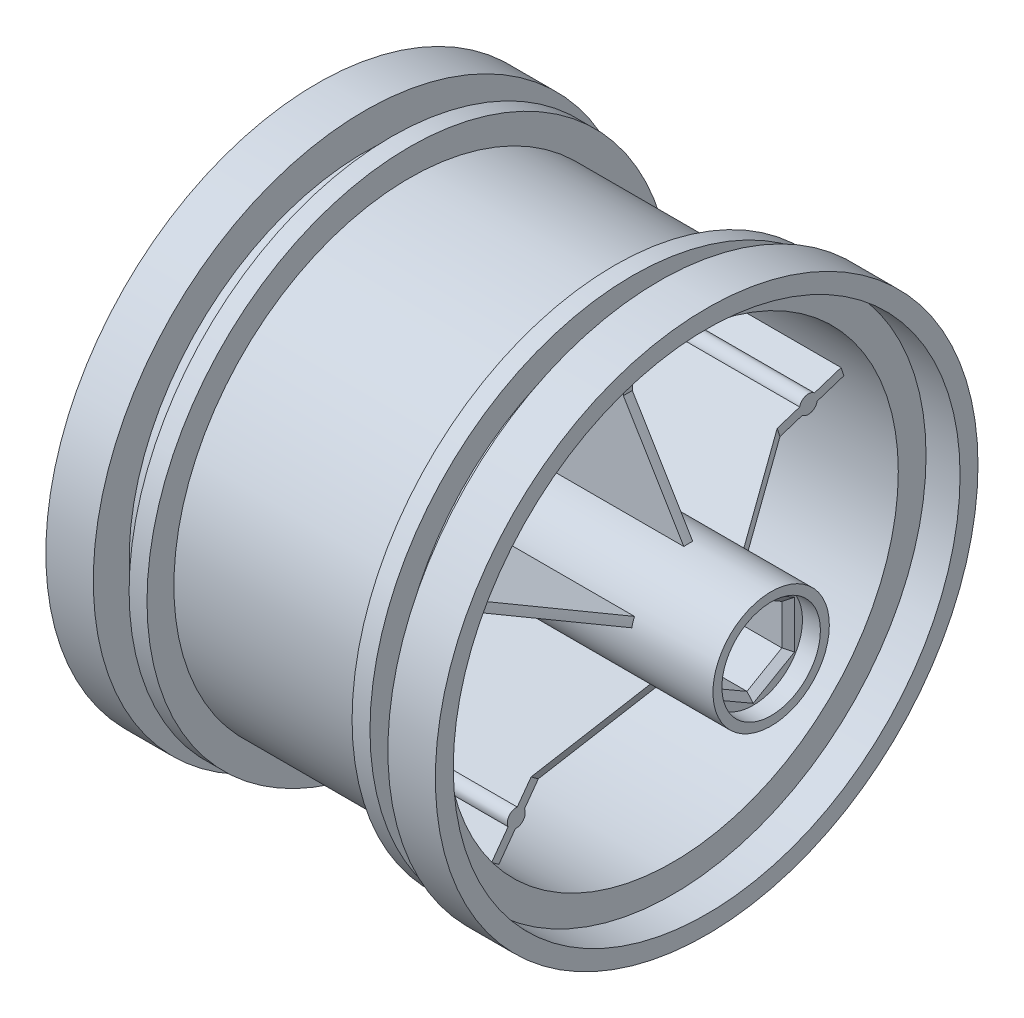
from build123d import *

# Parameters (mm, degrees)
CUT_EXTRUDE2_DEPTH  = 13
CHAMFER1_SIZE       = 0.7
SKETCH3_R           = 1.15
CUT_EXTRUDE3_DEPTH  = 56.815788354
SKETCH4_R           = 3
CUT_EXTRUDE4_DEPTH  = 19.5
BOSS_EXTRUDE1_REACH = 57.139
SKETCH6_W           = 2
SKETCH6_H           = 9.751628328
CUT_EXTRUDE7_DEPTH  = 0.5
CUT_EXTRUDE8_REACH  = 63.108
CUT_EXTRUDE9_DEPTH  = 67.382753784
FILLET3_R           = 0.3


with BuildPart() as part:
    # Sketch1 → Revolve1 (revolve)
    with BuildSketch(Plane.XY):
        with BuildLine():
            Line((-16.35, 0), (-16.35, 8.25))
            Line((-16.35, 8.25), (-14.85, 8.25))
            Line((-14.85, 8.25), (-14.85, 8.940811112))
            Line((-14.85, 8.940811112), (-27.35, 24.6))
            Line((-27.35, 24.6), (-29.35, 24.6))
            ThreePointArc((-29.35, 24.6), (-31.731701073, 25.735107238), (-32.35, 28.3))
            Line((-32.35, 28.3), (-32.35, 30.3))
            Line((-32.35, 30.3), (-27.05, 30.3))
            Line((-27.05, 30.3), (-27.05, 26.3))
            Line((-27.05, 26.3), (-24.05, 26.3))
            Line((-24.05, 26.3), (-24.05, 29.3))
            Line((-24.05, 29.3), (-22.05, 29.3))
            Line((-22.05, 29.3), (-22.05, 26.3))
            Line((-22.05, 26.3), (0.85, 26.3))
            Line((0.85, 26.3), (0.85, 29.3))
            Line((0.85, 29.3), (2.85, 29.3))
            Line((2.85, 29.3), (2.85, 26.3))
            Line((2.85, 26.3), (5.85, 26.3))
            Line((5.85, 26.3), (5.85, 30.3))
            Line((5.85, 30.3), (11.15, 30.3))
            Line((11.15, 30.3), (11.15, 28.3))
            Line((11.15, 28.3), (7.35, 28.3))
            Line((7.35, 28.3), (7.35, 25.2))
            Line((7.35, 25.2), (2.35, 25.2))
            Line((2.35, 25.2), (2.35, 17.7))
            Line((2.35, 17.7), (9.1, 6.5))
            Line((9.1, 6.5), (18.35, 6.5))
            Line((18.35, 6.5), (18.35, 5.5))
            Line((18.35, 5.5), (16.35, 5.5))
            Line((16.35, 5.5), (16.35, 0))
            Line((16.35, 0), (-16.35, 0))
        make_face()
    revolve(axis=Axis((16.35, 0, 0), (-1, 0, 0)))

    # Sketch2 → Cut-Extrude2 (cut)
    with BuildSketch(Plane(origin=(16.35, 0, 0), x_dir=(0, 0, -1), z_dir=(1, 0, 0))):
        Polygon((0, -4.5), (3.897114317, -2.25), (3.897114317, 2.25), (0, 4.5), (-3.897114317, 2.25), (-3.897114317, -2.25), align=None)
    extrude(amount=-CUT_EXTRUDE2_DEPTH, mode=Mode.SUBTRACT)

    # Chamfer1
    chamfer1_edges = [part.edges().sort_by_distance(p)[0] for p in [
        (16.35, -3.375, -1.948557159),
        (16.35, -3.375, 1.948557159),
        (16.35, 0, 3.897114317),
        (16.35, 3.375, 1.948557159),
        (16.35, 3.375, -1.948557159),
        (16.35, 0, -3.897114317),
    ]]
    chamfer(chamfer1_edges, length=CHAMFER1_SIZE)

    # Sketch3 → Cut-Extrude3 (cut, through all)
    with BuildSketch(Plane(origin=(3.35, 0, 0), x_dir=(0, 0, -1), z_dir=(1, 0, 0))):
        Circle(SKETCH3_R)
    extrude(amount=-CUT_EXTRUDE3_DEPTH, mode=Mode.SUBTRACT)

    # Sketch4 → Cut-Extrude4 (cut)
    with BuildSketch(Plane.ZY.offset(16.35)):
        Circle(SKETCH4_R)
    extrude(amount=-CUT_EXTRUDE4_DEPTH, mode=Mode.SUBTRACT)

    # Sketch6 → Boss-Extrude1 (add, up to next)
    with BuildSketch(Plane.ZY.offset(16.35), mode=Mode.PRIVATE) as boss_extrude1_sk1:
        with Locations((0, 10.317183644)):
            Rectangle(SKETCH6_W, SKETCH6_H)
    boss_extrude1_tool1 = extrude(boss_extrude1_sk1.sketch, amount=-BOSS_EXTRUDE1_REACH, mode=Mode.PRIVATE) - part.part
    # Sketch6 → Boss-Extrude1 (add, up to next)
    with BuildSketch(Plane.ZY.offset(16.35), mode=Mode.PRIVATE) as boss_extrude1_sk2:
        Polygon((5.484066896, 0.730419126), (14.758416562, 3.743838002), (14.140382573, 5.645951034), (4.866032907, 2.632532158), align=None)
    boss_extrude1_tool2 = extrude(boss_extrude1_sk2.sketch, amount=-BOSS_EXTRUDE1_REACH, mode=Mode.PRIVATE) - part.part
    # Sketch6 → Boss-Extrude1 (add, up to next)
    with BuildSketch(Plane.ZY.offset(16.35), mode=Mode.PRIVATE) as boss_extrude1_sk3:
        Polygon((2.389339738, -4.989945634), (8.121203055, -12.879178674), (9.739237044, -11.70360817), (4.007373727, -3.81437513), align=None)
    boss_extrude1_tool3 = extrude(boss_extrude1_sk3.sketch, amount=-BOSS_EXTRUDE1_REACH, mode=Mode.PRIVATE) - part.part
    # Sketch6 → Boss-Extrude1 (add, up to next)
    with BuildSketch(Plane.ZY.offset(16.35), mode=Mode.PRIVATE) as boss_extrude1_sk4:
        Polygon((-4.007373727, -3.81437513), (-9.739237044, -11.70360817), (-8.121203055, -12.879178674), (-2.389339738, -4.989945634), align=None)
    boss_extrude1_tool4 = extrude(boss_extrude1_sk4.sketch, amount=-BOSS_EXTRUDE1_REACH, mode=Mode.PRIVATE) - part.part
    # Sketch6 → Boss-Extrude1 (add, up to next)
    with BuildSketch(Plane.ZY.offset(16.35), mode=Mode.PRIVATE) as boss_extrude1_sk5:
        Polygon((-4.866032907, 2.632532158), (-14.140382573, 5.645951034), (-14.758416562, 3.743838002), (-5.484066896, 0.730419126), align=None)
    boss_extrude1_tool5 = extrude(boss_extrude1_sk5.sketch, amount=-BOSS_EXTRUDE1_REACH, mode=Mode.PRIVATE) - part.part
    add(boss_extrude1_tool1.solids().sort_by_distance((-16.35, 10.317184, 0))[0])
    add(boss_extrude1_tool2.solids().sort_by_distance((-16.35, 3.188185, 9.812225))[0])
    add(boss_extrude1_tool3.solids().sort_by_distance((-16.35, -8.346777, 6.064288))[0])
    add(boss_extrude1_tool4.solids().sort_by_distance((-16.35, -8.346777, -6.064288))[0])
    add(boss_extrude1_tool5.solids().sort_by_distance((-16.35, 3.188185, -9.812225))[0])

    # Sketch7 → Cut-Extrude7 (cut)
    with BuildSketch(Plane.ZY.offset(32.35)):
        with BuildLine():
            Line((-1.5, 26.457513111), (-1, 27.231645195))
            ThreePointArc((-1, 27.231645195), (0, 27.25), (1, 27.231645195))
            Line((1, 27.231645195), (1.5, 26.457513111))
            ThreePointArc((1.5, 26.457513111), (0, 26.5), (-1.5, 26.457513111))
        make_face()
        with BuildLine():
            Line((4.033604885, 26.191220507), (4.683629795, 26.844480102))
            ThreePointArc((4.683629795, 26.844480102), (5.665593575, 26.65452212), (6.639924997, 26.42865672))
            Line((6.639924997, 26.42865672), (6.968047687, 25.567485434))
            ThreePointArc((6.968047687, 25.567485434), (5.509659807, 25.920911419), (4.033604885, 26.191220507))
        make_face()
        with BuildLine():
            Line((9.39092188, 24.780245887), (10.162562494, 25.284082415))
            ThreePointArc((10.162562494, 25.284082415), (11.083573524, 24.894113721), (11.989653409, 24.470609129))
            Line((11.989653409, 24.470609129), (12.131558253, 23.560035958))
            ThreePointArc((12.131558253, 23.560035958), (10.778521042, 24.208954628), (9.39092188, 24.780245887))
        make_face()
        with BuildLine():
            Line((14.337810527, 22.286255614), (15.197342447, 22.618648999))
            ThreePointArc((15.197342447, 22.618648999), (16.017148125, 22.045713097), (16.815376435, 21.443078495))
            Line((16.815376435, 21.443078495), (16.76486151, 20.522899857))
            ThreePointArc((16.76486151, 20.522899857), (15.576309186, 21.438950351), (14.337810527, 22.286255614))
        make_face()
        with BuildLine():
            Line((18.658068054, 18.818249029), (19.567925609, 18.964672087))
            ThreePointArc((19.567925609, 18.964672087), (20.250696494, 18.233809023), (20.906186822, 17.478382436))
            Line((20.906186822, 17.478382436), (20.665459873, 16.588814552))
            ThreePointArc((20.665459873, 16.588814552), (19.693337875, 17.731961069), (18.658068054, 18.818249029))
        make_face()
        with BuildLine():
            Line((22.162878475, 14.527794661), (23.083296525, 14.481848001))
            ThreePointArc((23.083296525, 14.481848001), (23.599192253, 13.625), (24.083296525, 12.749797193))
            Line((24.083296525, 12.749797193), (23.662878475, 11.92971845))
            ThreePointArc((23.662878475, 11.92971845), (22.9496732, 13.25), (22.162878475, 14.527794661))
        make_face()
        with BuildLine():
            Line((24.699064757, 9.602405955), (25.589816617, 9.366097666))
            ThreePointArc((25.589816617, 9.366097666), (25.916290069, 8.420713097), (26.207850606, 7.463984634))
            Line((26.207850606, 7.463984634), (25.62611574, 6.749236406))
            ThreePointArc((25.62611574, 6.749236406), (25.202997682, 8.188950351), (24.699064757, 9.602405955))
        make_face()
        with BuildLine():
            Line((26.155783391, 4.25734603), (26.97793893, 3.84100392))
            ThreePointArc((26.97793893, 3.84100392), (27.100721649, 2.848400624), (27.186995856, 1.851960129))
            Line((27.186995856, 1.851960129), (26.46936878, 1.273780344))
            ThreePointArc((26.46936878, 1.273780344), (26.354830227, 2.770004277), (26.155783391, 4.25734603))
        make_face()
        with BuildLine():
            Line((26.46936878, -1.273780344), (27.186995856, -1.851960129))
            ThreePointArc((27.186995856, -1.851960129), (27.100721649, -2.848400624), (26.97793893, -3.84100392))
            Line((26.97793893, -3.84100392), (26.155783391, -4.25734603))
            ThreePointArc((26.155783391, -4.25734603), (26.354830227, -2.770004277), (26.46936878, -1.273780344))
        make_face()
        with BuildLine():
            Line((25.62611574, -6.749236406), (26.207850606, -7.463984634))
            ThreePointArc((26.207850606, -7.463984634), (25.916290069, -8.420713097), (25.589816617, -9.366097666))
            Line((25.589816617, -9.366097666), (24.699064757, -9.602405955))
            ThreePointArc((24.699064757, -9.602405955), (25.202997682, -8.188950351), (25.62611574, -6.749236406))
        make_face()
        with BuildLine():
            Line((23.662878475, -11.92971845), (24.083296525, -12.749797193))
            ThreePointArc((24.083296525, -12.749797193), (23.599192253, -13.625), (23.083296525, -14.481848001))
            Line((23.083296525, -14.481848001), (22.162878475, -14.527794661))
            ThreePointArc((22.162878475, -14.527794661), (22.9496732, -13.25), (23.662878475, -11.92971845))
        make_face()
        with BuildLine():
            Line((20.665459873, -16.588814552), (20.906186822, -17.478382436))
            ThreePointArc((20.906186822, -17.478382436), (20.250696494, -18.233809023), (19.567925609, -18.964672087))
            Line((19.567925609, -18.964672087), (18.658068054, -18.818249029))
            ThreePointArc((18.658068054, -18.818249029), (19.693337875, -17.731961069), (20.665459873, -16.588814552))
        make_face()
        with BuildLine():
            Line((16.76486151, -20.522899857), (16.815376435, -21.443078495))
            ThreePointArc((16.815376435, -21.443078495), (16.017148125, -22.045713097), (15.197342447, -22.618648999))
            Line((15.197342447, -22.618648999), (14.337810527, -22.286255614))
            ThreePointArc((14.337810527, -22.286255614), (15.576309186, -21.438950351), (16.76486151, -20.522899857))
        make_face()
        with BuildLine():
            Line((12.131558253, -23.560035958), (11.989653409, -24.470609129))
            ThreePointArc((11.989653409, -24.470609129), (11.083573524, -24.894113721), (10.162562494, -25.284082415))
            Line((10.162562494, -25.284082415), (9.39092188, -24.780245887))
            ThreePointArc((9.39092188, -24.780245887), (10.778521042, -24.208954628), (12.131558253, -23.560035958))
        make_face()
        with BuildLine():
            Line((6.968047687, -25.567485434), (6.639924997, -26.42865672))
            ThreePointArc((6.639924997, -26.42865672), (5.665593575, -26.65452212), (4.683629795, -26.844480102))
            Line((4.683629795, -26.844480102), (4.033604885, -26.191220507))
            ThreePointArc((4.033604885, -26.191220507), (5.509659807, -25.920911419), (6.968047687, -25.567485434))
        make_face()
        with BuildLine():
            Line((1.5, -26.457513111), (1, -27.231645195))
            ThreePointArc((1, -27.231645195), (0, -27.25), (-1, -27.231645195))
            Line((-1, -27.231645195), (-1.5, -26.457513111))
            ThreePointArc((-1.5, -26.457513111), (0, -26.5), (1.5, -26.457513111))
        make_face()
        with BuildLine():
            Line((-4.033604885, -26.191220507), (-4.683629795, -26.844480102))
            ThreePointArc((-4.683629795, -26.844480102), (-5.665593575, -26.65452212), (-6.639924997, -26.42865672))
            Line((-6.639924997, -26.42865672), (-6.968047687, -25.567485434))
            ThreePointArc((-6.968047687, -25.567485434), (-5.509659807, -25.920911419), (-4.033604885, -26.191220507))
        make_face()
        with BuildLine():
            Line((-9.39092188, -24.780245887), (-10.162562494, -25.284082415))
            ThreePointArc((-10.162562494, -25.284082415), (-11.083573524, -24.894113721), (-11.989653409, -24.470609129))
            Line((-11.989653409, -24.470609129), (-12.131558253, -23.560035958))
            ThreePointArc((-12.131558253, -23.560035958), (-10.778521042, -24.208954628), (-9.39092188, -24.780245887))
        make_face()
        with BuildLine():
            Line((-14.337810527, -22.286255614), (-15.197342447, -22.618648999))
            ThreePointArc((-15.197342447, -22.618648999), (-16.017148125, -22.045713097), (-16.815376435, -21.443078495))
            Line((-16.815376435, -21.443078495), (-16.76486151, -20.522899857))
            ThreePointArc((-16.76486151, -20.522899857), (-15.576309186, -21.438950351), (-14.337810527, -22.286255614))
        make_face()
        with BuildLine():
            Line((-18.658068054, -18.818249029), (-19.567925609, -18.964672087))
            ThreePointArc((-19.567925609, -18.964672087), (-20.250696494, -18.233809023), (-20.906186822, -17.478382436))
            Line((-20.906186822, -17.478382436), (-20.665459873, -16.588814552))
            ThreePointArc((-20.665459873, -16.588814552), (-19.693337875, -17.731961069), (-18.658068054, -18.818249029))
        make_face()
        with BuildLine():
            Line((-22.162878475, -14.527794661), (-23.083296525, -14.481848001))
            ThreePointArc((-23.083296525, -14.481848001), (-23.599192253, -13.625), (-24.083296525, -12.749797193))
            Line((-24.083296525, -12.749797193), (-23.662878475, -11.92971845))
            ThreePointArc((-23.662878475, -11.92971845), (-22.9496732, -13.25), (-22.162878475, -14.527794661))
        make_face()
        with BuildLine():
            Line((-24.699064757, -9.602405955), (-25.589816617, -9.366097666))
            ThreePointArc((-25.589816617, -9.366097666), (-25.916290069, -8.420713097), (-26.207850606, -7.463984634))
            Line((-26.207850606, -7.463984634), (-25.62611574, -6.749236406))
            ThreePointArc((-25.62611574, -6.749236406), (-25.202997682, -8.188950351), (-24.699064757, -9.602405955))
        make_face()
        with BuildLine():
            Line((-26.155783391, -4.25734603), (-26.97793893, -3.84100392))
            ThreePointArc((-26.97793893, -3.84100392), (-27.100721649, -2.848400624), (-27.186995856, -1.851960129))
            Line((-27.186995856, -1.851960129), (-26.46936878, -1.273780344))
            ThreePointArc((-26.46936878, -1.273780344), (-26.354830227, -2.770004277), (-26.155783391, -4.25734603))
        make_face()
        with BuildLine():
            Line((-26.46936878, 1.273780344), (-27.186995856, 1.851960129))
            ThreePointArc((-27.186995856, 1.851960129), (-27.100721649, 2.848400624), (-26.97793893, 3.84100392))
            Line((-26.97793893, 3.84100392), (-26.155783391, 4.25734603))
            ThreePointArc((-26.155783391, 4.25734603), (-26.354830227, 2.770004277), (-26.46936878, 1.273780344))
        make_face()
        with BuildLine():
            Line((-25.62611574, 6.749236406), (-26.207850606, 7.463984634))
            ThreePointArc((-26.207850606, 7.463984634), (-25.916290069, 8.420713097), (-25.589816617, 9.366097666))
            Line((-25.589816617, 9.366097666), (-24.699064757, 9.602405955))
            ThreePointArc((-24.699064757, 9.602405955), (-25.202997682, 8.188950351), (-25.62611574, 6.749236406))
        make_face()
        with BuildLine():
            Line((-23.662878475, 11.92971845), (-24.083296525, 12.749797193))
            ThreePointArc((-24.083296525, 12.749797193), (-23.599192253, 13.625), (-23.083296525, 14.481848001))
            Line((-23.083296525, 14.481848001), (-22.162878475, 14.527794661))
            ThreePointArc((-22.162878475, 14.527794661), (-22.9496732, 13.25), (-23.662878475, 11.92971845))
        make_face()
        with BuildLine():
            Line((-20.665459873, 16.588814552), (-20.906186822, 17.478382436))
            ThreePointArc((-20.906186822, 17.478382436), (-20.250696494, 18.233809023), (-19.567925609, 18.964672087))
            Line((-19.567925609, 18.964672087), (-18.658068054, 18.818249029))
            ThreePointArc((-18.658068054, 18.818249029), (-19.693337875, 17.731961069), (-20.665459873, 16.588814552))
        make_face()
        with BuildLine():
            Line((-16.76486151, 20.522899857), (-16.815376435, 21.443078495))
            ThreePointArc((-16.815376435, 21.443078495), (-16.017148125, 22.045713097), (-15.197342447, 22.618648999))
            Line((-15.197342447, 22.618648999), (-14.337810527, 22.286255614))
            ThreePointArc((-14.337810527, 22.286255614), (-15.576309186, 21.438950351), (-16.76486151, 20.522899857))
        make_face()
        with BuildLine():
            Line((-12.131558253, 23.560035958), (-11.989653409, 24.470609129))
            ThreePointArc((-11.989653409, 24.470609129), (-11.083573524, 24.894113721), (-10.162562494, 25.284082415))
            Line((-10.162562494, 25.284082415), (-9.39092188, 24.780245887))
            ThreePointArc((-9.39092188, 24.780245887), (-10.778521042, 24.208954628), (-12.131558253, 23.560035958))
        make_face()
        with BuildLine():
            Line((-6.968047687, 25.567485434), (-6.639924997, 26.42865672))
            ThreePointArc((-6.639924997, 26.42865672), (-5.665593575, 26.65452212), (-4.683629795, 26.844480102))
            Line((-4.683629795, 26.844480102), (-4.033604885, 26.191220507))
            ThreePointArc((-4.033604885, 26.191220507), (-5.509659807, 25.920911419), (-6.968047687, 25.567485434))
        make_face()
    extrude(amount=-CUT_EXTRUDE7_DEPTH, mode=Mode.SUBTRACT)

    # Cut-Extrude8: up to this cone (the profile starts outside it)
    cut_extrude8_end = Plane(origin=(11.15, 0, 0), z_dir=(-1, 0, 0)).offset(18.862968571) * Cone(1.253e-06, 56.053673167, 44.745031429, align=(Align.CENTER, Align.CENTER, Align.MIN), mode=Mode.PRIVATE)
    # Sketch10 → Cut-Extrude8 (cut, up to the surface)
    with BuildSketch(Plane(origin=(11.15, 0, 0), x_dir=(0, 0, -1), z_dir=(1, 0, 0)), mode=Mode.PRIVATE) as cut_extrude8_sk1:
        with BuildLine():
            Line((0.5, 25.195039194), (0.5, 22.066025404))
            ThreePointArc((0.5, 22.066025404), (1, 21.2), (0.5, 20.333974596))
            Line((0.5, 20.333974596), (0.5, 6.480740698))
            ThreePointArc((0.5, 6.480740698), (3.82060414, 5.258610463), (6.009042174, 2.47818727))
            Line((6.009042174, 2.47818727), (19.184250545, 6.759071972))
            ThreePointArc((19.184250545, 6.759071972), (19.853381151, 7.502216797), (20.831528752, 7.294305106))
            Line((20.831528752, 7.294305106), (23.807397707, 8.261223543))
            ThreePointArc((23.807397707, 8.261223543), (14.812188358, 20.387228258), (0.5, 25.195039194))
        make_face()
    cut_extrude8_tool1 = extrude(cut_extrude8_sk1.sketch, amount=-CUT_EXTRUDE8_REACH, mode=Mode.PRIVATE) - cut_extrude8_end
    add(cut_extrude8_tool1.solids().sort_by_distance((11.15, 13.537997, -9.835931))[0], mode=Mode.SUBTRACT)
    # Sketch10 → Cut-Extrude8 (cut, up to the surface)
    with BuildSketch(Plane(origin=(11.15, 0, 0), x_dir=(0, 0, -1), z_dir=(1, 0, 0)), mode=Mode.PRIVATE) as cut_extrude8_sk2:
        with BuildLine():
            Line((-0.5, 20.333974596), (-0.5, 6.480740698))
            ThreePointArc((-0.5, 6.480740698), (-3.82060414, 5.258610463), (-6.009042174, 2.47818727))
            Line((-6.009042174, 2.47818727), (-19.184250545, 6.759071972))
            ThreePointArc((-19.184250545, 6.759071972), (-19.853381151, 7.502216797), (-20.831528752, 7.294305106))
            Line((-20.831528752, 7.294305106), (-23.807397707, 8.261223543))
            ThreePointArc((-23.807397707, 8.261223543), (-14.812188358, 20.387228258), (-0.5, 25.195039194))
            Line((-0.5, 25.195039194), (-0.5, 22.066025404))
            ThreePointArc((-0.5, 22.066025404), (-1, 21.2), (-0.5, 20.333974596))
        make_face()
    cut_extrude8_tool2 = extrude(cut_extrude8_sk2.sketch, amount=-CUT_EXTRUDE8_REACH, mode=Mode.PRIVATE) - cut_extrude8_end
    add(cut_extrude8_tool2.solids().sort_by_distance((11.15, 13.537997, 9.835931))[0], mode=Mode.SUBTRACT)
    # Sketch10 → Cut-Extrude8 (cut, up to the surface)
    with BuildSketch(Plane(origin=(11.15, 0, 0), x_dir=(0, 0, -1), z_dir=(1, 0, 0)), mode=Mode.PRIVATE) as cut_extrude8_sk3:
        with BuildLine():
            Line((24.116414701, 7.310167027), (21.140545746, 6.34324859))
            ThreePointArc((21.140545746, 6.34324859), (20.47141514, 5.600103764), (19.493267539, 5.808015455))
            Line((19.493267539, 5.808015455), (6.318059169, 1.527130754))
            ThreePointArc((6.318059169, 1.527130754), (6.181867356, -2.008610463), (4.213792304, -4.949136735))
            Line((4.213792304, -4.949136735), (12.356518885, -16.156638385))
            ThreePointArc((12.356518885, -16.156638385), (13.270064343, -16.563375028), (13.374592806, -17.557896924))
            Line((13.374592806, -17.557896924), (15.213780967, -20.089322256))
            ThreePointArc((15.213780967, -20.089322256), (23.966624211, -7.787228258), (24.116414701, 7.310167027))
        make_face()
    cut_extrude8_tool3 = extrude(cut_extrude8_sk3.sketch, amount=-CUT_EXTRUDE8_REACH, mode=Mode.PRIVATE) - cut_extrude8_end
    add(cut_extrude8_tool3.solids().sort_by_distance((11.15, -5.171055, -15.91487))[0], mode=Mode.SUBTRACT)
    # Sketch10 → Cut-Extrude8 (cut, up to the surface)
    with BuildSketch(Plane(origin=(11.15, 0, 0), x_dir=(0, 0, -1), z_dir=(1, 0, 0)), mode=Mode.PRIVATE) as cut_extrude8_sk4:
        with BuildLine():
            Line((14.404763972, -20.677107508), (12.565575812, -18.145682176))
            ThreePointArc((12.565575812, -18.145682176), (11.652030354, -17.738945533), (11.547501891, -16.744423638))
            Line((11.547501891, -16.744423638), (3.404775309, -5.536921987))
            ThreePointArc((3.404775309, -5.536921987), (0, -6.5), (-3.404775309, -5.536921987))
            Line((-3.404775309, -5.536921987), (-11.547501891, -16.744423638))
            ThreePointArc((-11.547501891, -16.744423638), (-11.652030354, -17.738945533), (-12.565575812, -18.145682176))
            Line((-12.565575812, -18.145682176), (-14.404763972, -20.677107508))
            ThreePointArc((-14.404763972, -20.677107508), (0, -25.2), (14.404763972, -20.677107508))
        make_face()
    cut_extrude8_tool4 = extrude(cut_extrude8_sk4.sketch, amount=-CUT_EXTRUDE8_REACH, mode=Mode.PRIVATE) - cut_extrude8_end
    add(cut_extrude8_tool4.solids().sort_by_distance((11.15, -16.733885, 0))[0], mode=Mode.SUBTRACT)
    # Sketch10 → Cut-Extrude8 (cut, up to the surface)
    with BuildSketch(Plane(origin=(11.15, 0, 0), x_dir=(0, 0, -1), z_dir=(1, 0, 0)), mode=Mode.PRIVATE) as cut_extrude8_sk5:
        with BuildLine():
            Line((-15.213780967, -20.089322256), (-13.374592806, -17.557896924))
            ThreePointArc((-13.374592806, -17.557896924), (-13.270064343, -16.563375028), (-12.356518885, -16.156638385))
            Line((-12.356518885, -16.156638385), (-4.213792304, -4.949136735))
            ThreePointArc((-4.213792304, -4.949136735), (-6.181867356, -2.008610463), (-6.318059169, 1.527130754))
            Line((-6.318059169, 1.527130754), (-19.493267539, 5.808015455))
            ThreePointArc((-19.493267539, 5.808015455), (-20.47141514, 5.600103764), (-21.140545746, 6.34324859))
            Line((-21.140545746, 6.34324859), (-24.116414701, 7.310167027))
            ThreePointArc((-24.116414701, 7.310167027), (-23.966624211, -7.787228258), (-15.213780967, -20.089322256))
        make_face()
    cut_extrude8_tool5 = extrude(cut_extrude8_sk5.sketch, amount=-CUT_EXTRUDE8_REACH, mode=Mode.PRIVATE) - cut_extrude8_end
    add(cut_extrude8_tool5.solids().sort_by_distance((11.15, -5.171055, 15.91487))[0], mode=Mode.SUBTRACT)

    # Sketch11 → Revolve2 (revolve)
    with BuildSketch(Plane.XY):
        Polygon((-27.82895201, 25.195039194), (-12.901614351, 6.480740698), (-11.622460304, 6.480740698), (-26.549797963, 25.195039194), align=None)
    revolve(axis=Axis((48.723629331, 0, 0), (-1, 0, 0)))

    # Sketch12 → Cut-Extrude9 (cut, through all)
    with BuildSketch(Plane.ZY.offset(32.35)):
        with BuildLine():
            Line((9.930294902, 11.664902767), (20.491286559, 9.840959282))
            ThreePointArc((20.491286559, 9.840959282), (21.422974919, 10.21816936), (21.497963261, 11.220520293))
            ThreePointArc((21.497963261, 11.220520293), (14.253792368, 19.618662114), (4.028112949, 23.913109502))
            ThreePointArc((4.028112949, 23.913109502), (3.097993235, 23.532047879), (3.027152668, 22.529395269))
            Line((3.027152668, 22.529395269), (8.025351904, 13.048924868))
            ThreePointArc((8.025351904, 13.048924868), (8.816778784, 12.135254916), (9.930294902, 11.664902767))
        make_face()
        with BuildLine():
            Line((14.162611672, -5.839618483), (15.691464235, -16.44734795))
            ThreePointArc((15.691464235, -16.44734795), (16.338119875, -17.216871912), (17.314584933, -16.97844659))
            ThreePointArc((17.314584933, -16.97844659), (23.06312052, -7.493662114), (23.987473974, 3.558594156))
            ThreePointArc((23.987473974, 3.558594156), (23.337640035, 4.325436054), (22.362169797, 4.08297274))
            Line((22.362169797, 4.08297274), (14.890235151, -3.600223681))
            ThreePointArc((14.890235151, -3.600223681), (14.265847744, -4.635254916), (14.162611672, -5.839618483))
        make_face()
        with BuildLine():
            Line((-1.177319519, -15.273985471), (-10.793428329, -20.00597934))
            ThreePointArc((-10.793428329, -20.00597934), (-11.325461524, -20.858781382), (-10.796961271, -21.713777362))
            ThreePointArc((-10.796961271, -21.713777362), (0, -24.25), (10.796961271, -21.713777362))
            ThreePointArc((10.796961271, -21.713777362), (11.325461524, -20.858781382), (10.793428329, -20.00597934))
            Line((10.793428329, -20.00597934), (1.177319519, -15.273985471))
            ThreePointArc((1.177319519, -15.273985471), (0, -15), (-1.177319519, -15.273985471))
        make_face()
        with BuildLine():
            Line((-14.890235151, -3.600223681), (-22.362169797, 4.08297274))
            ThreePointArc((-22.362169797, 4.08297274), (-23.337640035, 4.325436054), (-23.987473974, 3.558594156))
            ThreePointArc((-23.987473974, 3.558594156), (-23.06312052, -7.493662114), (-17.314584933, -16.97844659))
            ThreePointArc((-17.314584933, -16.97844659), (-16.338119875, -17.216871912), (-15.691464235, -16.44734795))
            Line((-15.691464235, -16.44734795), (-14.162611672, -5.839618483))
            ThreePointArc((-14.162611672, -5.839618483), (-14.265847744, -4.635254916), (-14.890235151, -3.600223681))
        make_face()
        with BuildLine():
            Line((-8.025351904, 13.048924868), (-3.027152668, 22.529395269))
            ThreePointArc((-3.027152668, 22.529395269), (-3.097993235, 23.532047879), (-4.028112949, 23.913109502))
            ThreePointArc((-4.028112949, 23.913109502), (-14.253792368, 19.618662114), (-21.497963261, 11.220520293))
            ThreePointArc((-21.497963261, 11.220520293), (-21.422974919, 10.21816936), (-20.491286559, 9.840959282))
            Line((-20.491286559, 9.840959282), (-9.930294902, 11.664902767))
            ThreePointArc((-9.930294902, 11.664902767), (-8.816778784, 12.135254916), (-8.025351904, 13.048924868))
        make_face()
    extrude(amount=-CUT_EXTRUDE9_DEPTH, mode=Mode.SUBTRACT)

    # Fillet3
    fillet3_edges = [part.edges().sort_by_distance(p)[0] for p in [
        (-16.35, -8.25, 0),
        (-16.35, -2.549390204, 7.846216259),
        (-16.35, 6.674390204, 4.849228331),
        (-16.35, 6.674390204, -4.849228331),
        (-16.35, -2.549390204, -7.846216259),
        (-16.35, -7.076335464, 6.377326634),
        (-16.35, -8.251905968, 4.759292646),
        (-16.35, -8.251905968, -4.759292646),
        (-16.35, -7.076335464, -6.377326634),
        (-16.35, 1.976377103, -9.318731252),
        (-16.35, 3.878490136, -8.700697263),
        (-16.35, 9.473374193, 1),
        (-16.35, 9.473374193, -1),
        (-16.35, 3.878490136, 8.700697263),
        (-16.35, 1.976377103, 9.318731252),
    ]]
    fillet(fillet3_edges, radius=FILLET3_R)


solid = part.part
